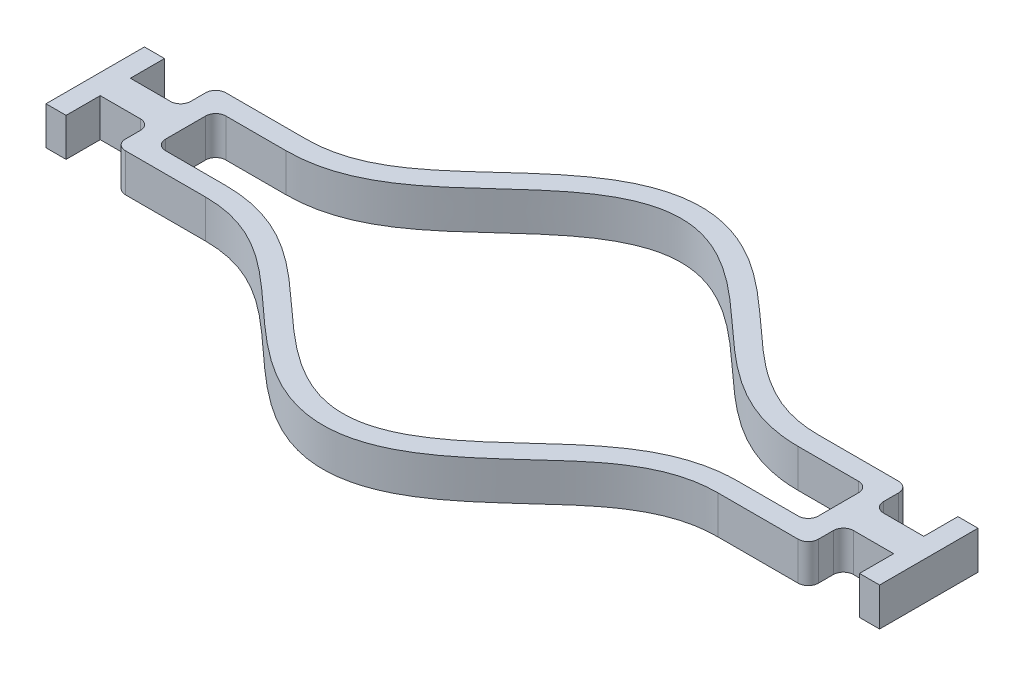
from build123d import *

# Parameters (mm, degrees)
BOSS_EXTRUDE1_DEPTH = 3.8
FILLET1_R           = 1
FILLET2_R           = 1


# Read off the part's stored shape, not the designer's step: Boss-Extrude1
with BuildPart() as part:
    # Boss-Extrude1 outline → Boss-Extrude1 (new body)
    with BuildSketch(Plane(origin=(0, 0, 0), x_dir=(1, 0, 0), z_dir=(0, 1, 0))):
        with BuildLine():
            Line((-67, -3.5), (-72, -3.5))
            Line((-72, -3.5), (-72, -0.1))
            Line((-72, -0.1), (-74, -0.1))
            Line((-74, -0.1), (-74, -9.9))
            Line((-74, -9.9), (-72, -9.9))
            Line((-72, -9.9), (-72, -6.5))
            Line((-72, -6.5), (-67, -6.5))
            Line((-67, -6.5), (-67, -10))
            Line((-67, -10), (-58, -10))
            add(Edge.make_bspline(
                [(-58, -10), (-43, -10), (-43, -32.135135135), (-22, -32.135135135), (-22, -10), (-7, -10)],
                knots=[0, 0, 0, 0, 0, 0, 1, 1, 1, 1, 1, 1], degree=5))
            Line((-7, -10), (2, -10))
            Line((2, -10), (2, -6.5))
            Line((2, -6.5), (7, -6.5))
            Line((7, -6.5), (7, -9.9))
            Line((7, -9.9), (9, -9.9))
            Line((9, -9.9), (9, -0.1))
            Line((9, -0.1), (7, -0.1))
            Line((7, -0.1), (7, -3.5))
            Line((7, -3.5), (2, -3.5))
            Line((2, -3.5), (2, 0))
            Line((2, 0), (-7, 0))
            add(Edge.make_bspline(
                [(-58, 0), (-43, 0), (-43, 22.135135135), (-22, 22.135135135), (-22, 0), (-7, 0)],
                knots=[0, 0, 0, 0, 0, 0, 1, 1, 1, 1, 1, 1], degree=5))
            Line((-58, 0), (-67, 0))
            Line((-67, 0), (-67, -3.5))
        make_face()
        with BuildLine():
            Line((-7, -2), (0, -2))
            Line((0, -2), (0, -8))
            Line((0, -8), (-7, -8))
            add(Edge.make_bspline(
                [(-58, -8), (-57.558618283, -8), (-56.661274976, -8.041762499), (-54.994490556, -8.279551492), (-53.066007456, -8.837716096), (-51.014248285, -9.814804326), (-48.564524406, -11.386984706), (-45.904801681, -13.642773041), (-43.012545098, -16.349497976), (-40.249484403, -18.726076341), (-37.565229513, -20.52340788), (-34.980845565, -21.601809204), (-32.5, -21.950784587), (-30.019154435, -21.601809204), (-27.434770487, -20.52340788), (-24.750515597, -18.726076341), (-21.987454902, -16.349497976), (-19.095198319, -13.642773041), (-16.435475594, -11.386984706), (-13.985751715, -9.814804326), (-11.933992544, -8.837716096), (-10.005509444, -8.279551492), (-8.338725024, -8.041762499), (-7.441381717, -8), (-7, -8)],
                knots=[0, 0, 0, 0, 0.015625, 0.03125, 0.0625, 0.09375, 0.125, 0.1875, 0.25, 0.3125, 0.375, 0.4375, 0.5, 0.5625, 0.625, 0.6875, 0.75, 0.8125, 0.875, 0.90625, 0.9375, 0.96875, 0.984375, 1, 1, 1, 1], degree=3))
            Line((-58, -8), (-65, -8))
            Line((-65, -8), (-65, -2))
            Line((-65, -2), (-58, -2))
            add(Edge.make_bspline(
                [(-58, -2), (-57.558618283, -2), (-56.661274976, -1.958237501), (-54.994490556, -1.720448508), (-53.066007456, -1.162283904), (-51.014248285, -0.185195674), (-48.564524406, 1.386984706), (-45.904801681, 3.642773041), (-43.012545098, 6.349497976), (-40.249484403, 8.726076341), (-37.565229513, 10.52340788), (-34.980845565, 11.601809204), (-32.5, 11.950784587), (-30.019154435, 11.601809204), (-27.434770487, 10.52340788), (-24.750515597, 8.726076341), (-21.987454902, 6.349497976), (-19.095198319, 3.642773041), (-16.435475594, 1.386984706), (-13.985751715, -0.185195674), (-11.933992544, -1.162283904), (-10.005509444, -1.720448508), (-8.338725024, -1.958237501), (-7.441381717, -2), (-7, -2)],
                knots=[0, 0, 0, 0, 0.015625, 0.03125, 0.0625, 0.09375, 0.125, 0.1875, 0.25, 0.3125, 0.375, 0.4375, 0.5, 0.5625, 0.625, 0.6875, 0.75, 0.8125, 0.875, 0.90625, 0.9375, 0.96875, 0.984375, 1, 1, 1, 1], degree=3))
        make_face(mode=Mode.SUBTRACT)
    extrude(amount=BOSS_EXTRUDE1_DEPTH)

    # Fillet1
    fillet1_edges = [part.edges().sort_by_distance(p)[0] for p in [
        (-67, 1.9, 3.5),
        (-67, 1.9, 0),
        (2, 1.9, 0),
        (2, 1.9, 3.5),
        (2, 1.9, 6.5),
        (2, 1.9, 10),
        (-67, 1.9, 10),
        (-67, 1.9, 6.5),
    ]]
    fillet(fillet1_edges, radius=FILLET1_R)

    # Fillet2
    fillet2_edges = [part.edges().sort_by_distance(p)[0] for p in [
        (-65, 1.9, 2),
        (-65, 1.9, 8),
        (0, 1.9, 8),
        (0, 1.9, 2),
    ]]
    fillet(fillet2_edges, radius=FILLET2_R)


solid = part.part
